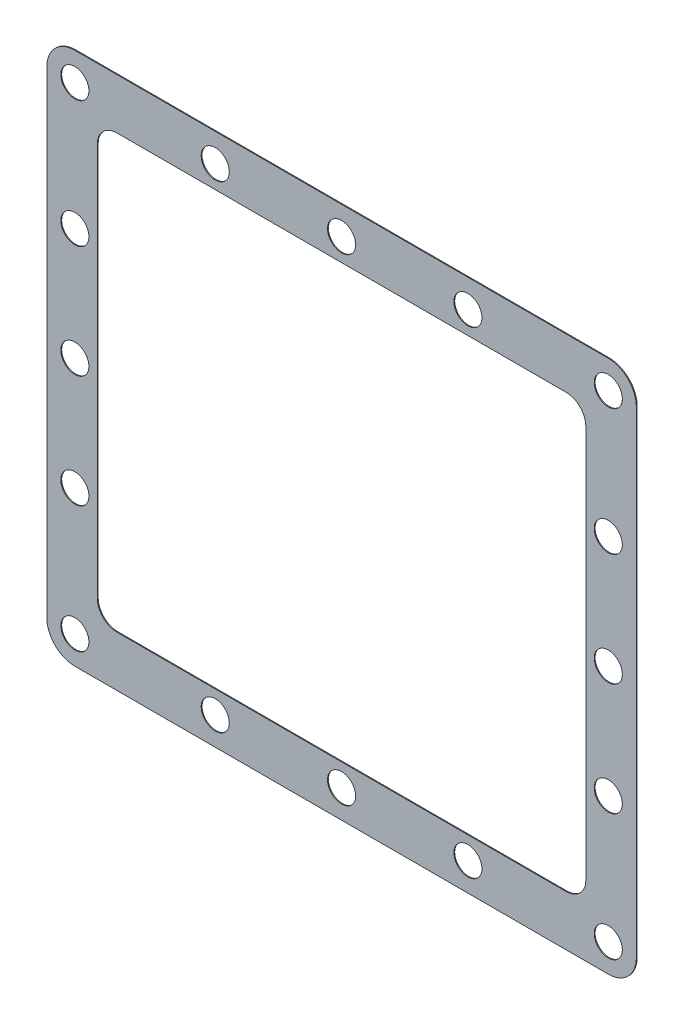
from build123d import *

# Parameters (mm, degrees)
SKETCH_1_R      = 5
EXTRUDE_1_DEPTH = 0.3


with BuildPart() as part:
    # 草图1 → 凸台-拉伸1 (new body)
    with BuildSketch(Plane.XY):
        with BuildLine():
            Line((-95, -95), (95, -95))
            ThreePointArc((95, -95), (102.071067812, -92.071067812), (105, -85))
            Line((105, -85), (105, 85))
            ThreePointArc((105, 85), (102.071067812, 92.071067812), (95, 95))
            Line((95, 95), (-95, 95))
            ThreePointArc((-95, 95), (-102.071067812, 92.071067812), (-105, 85))
            Line((-105, 85), (-105, -85))
            ThreePointArc((-105, -85), (-102.071067812, -92.071067812), (-95, -95))
        make_face()
        with Locations((95, -85)):
            Circle(SKETCH_1_R, mode=Mode.SUBTRACT)
        with Locations((95, 85)):
            Circle(SKETCH_1_R, mode=Mode.SUBTRACT)
        with Locations((-95, 85)):
            Circle(SKETCH_1_R, mode=Mode.SUBTRACT)
        with Locations((-95, -85)):
            Circle(SKETCH_1_R, mode=Mode.SUBTRACT)
        with Locations((95, 0)):
            Circle(SKETCH_1_R, mode=Mode.SUBTRACT)
        with Locations((95, -40)):
            Circle(SKETCH_1_R, mode=Mode.SUBTRACT)
        with Locations((95, 40)):
            Circle(SKETCH_1_R, mode=Mode.SUBTRACT)
        with Locations((-95, -40)):
            Circle(SKETCH_1_R, mode=Mode.SUBTRACT)
        with Locations((-95, 0)):
            Circle(SKETCH_1_R, mode=Mode.SUBTRACT)
        with Locations((-95, 40)):
            Circle(SKETCH_1_R, mode=Mode.SUBTRACT)
        with Locations((0, 85)):
            Circle(SKETCH_1_R, mode=Mode.SUBTRACT)
        with Locations((-45, 85)):
            Circle(SKETCH_1_R, mode=Mode.SUBTRACT)
        with Locations((45, 85)):
            Circle(SKETCH_1_R, mode=Mode.SUBTRACT)
        with Locations((0, -85)):
            Circle(SKETCH_1_R, mode=Mode.SUBTRACT)
        with Locations((-45, -85)):
            Circle(SKETCH_1_R, mode=Mode.SUBTRACT)
        with Locations((45, -85)):
            Circle(SKETCH_1_R, mode=Mode.SUBTRACT)
        with BuildLine():
            Line((-80, -77), (80, -77))
            ThreePointArc((80, -77), (84.949747468, -74.949747468), (87, -70))
            Line((87, -70), (87, 70))
            ThreePointArc((87, 70), (84.949747468, 74.949747468), (80, 77))
            Line((80, 77), (-80, 77))
            ThreePointArc((-80, 77), (-84.949747468, 74.949747468), (-87, 70))
            Line((-87, 70), (-87, -70))
            ThreePointArc((-87, -70), (-84.949747468, -74.949747468), (-80, -77))
        make_face(mode=Mode.SUBTRACT)
    extrude(amount=EXTRUDE_1_DEPTH)


solid = part.part
